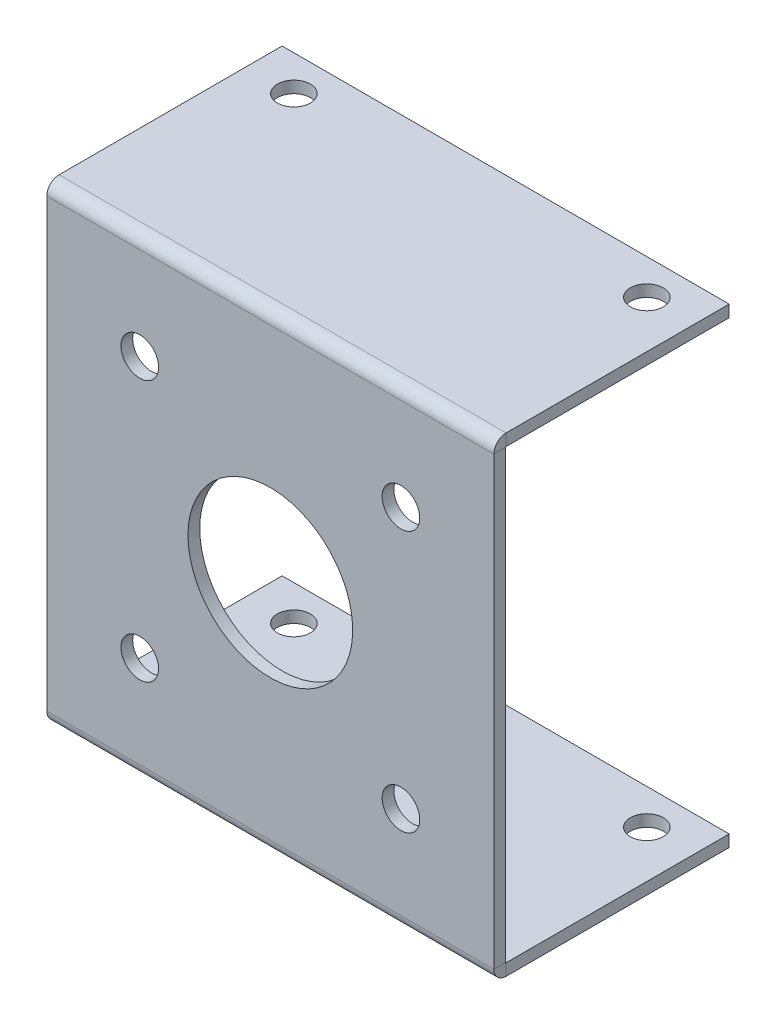
from build123d import *

# Parameters (mm, degrees)
SKETCH1_W                    = 190
SKETCH1_H                    = 200
BASE_FLANGE1_DEPTH           = 5
EDGE_FLANGE1_STRIP_W         = 20.4
EDGE_FLANGE1_STRIP_H         = 5
EDGE_FLANGE1_STRIP_CUT_DEPTH = 190
EDGE_FLANGE1_DEPTH           = 190
EDGE_FLANGE2_STRIP_W         = 20.4
EDGE_FLANGE2_STRIP_H         = 5
EDGE_FLANGE2_STRIP_CUT_DEPTH = 190
EDGE_FLANGE2_DEPTH           = 190
CUT_EXTRUDE1_DEPTH           = 171.367250374
CUT_EXTRUDE1_DEPTH_BACK      = 171.367250374
SKETCH12_R                   = 35
CUT_EXTRUDE2_DEPTH           = 171.367250374
CUT_EXTRUDE2_DEPTH_BACK      = 171.367250374
SKETCH13_R                   = 8
CUT_EXTRUDE3_DEPTH           = 243.950612265
CUT_EXTRUDE3_DEPTH_BACK      = 243.950612265
SKETCH14_R                   = 7


# Sheet-metal steps are written as plain solids
with BuildPart() as part:
    # Sketch1 → Base-Flange1 (new body)
    with BuildSketch(Plane.XY):
        Rectangle(SKETCH1_W, SKETCH1_H)
    extrude(amount=-BASE_FLANGE1_DEPTH)

    # Edge-Flange1 strip (across the edge) → Edge-Flange1 strip cut (cut)
    with BuildSketch(Plane(origin=(-95, 100, -5), x_dir=(0, -1, 0), z_dir=(1, 0, 0))):
        with Locations((-5, -2.5)):
            Rectangle(EDGE_FLANGE1_STRIP_W, EDGE_FLANGE1_STRIP_H)
    extrude(amount=EDGE_FLANGE1_STRIP_CUT_DEPTH, mode=Mode.SUBTRACT)

    # Edge-Flange1 section (across the edge) → Edge-Flange1 (add)
    with BuildSketch(Plane(origin=(-95, 100, -5), x_dir=(0, -1, 0), z_dir=(1, 0, 0))):
        with BuildLine():
            Line((0, 0.2), (0, 95))
            Line((0, 95), (5, 95))
            Line((5, 95), (5, 0.2))
            ThreePointArc((5, 0.2), (5.058578644, 0.058578644), (5.2, 0))
            Line((5.2, 0), (5.2, -5))
            ThreePointArc((5.2, -5), (1.523044738, -3.476955262), (0, 0.2))
        make_face()
    extrude(amount=EDGE_FLANGE1_DEPTH)

    # Edge-Flange2 strip (across the edge) → Edge-Flange2 strip cut (cut)
    with BuildSketch(Plane(origin=(95, -100, -5), x_dir=(0, 1, 0), z_dir=(-1, 0, 0))):
        with Locations((-5, -2.5)):
            Rectangle(EDGE_FLANGE2_STRIP_W, EDGE_FLANGE2_STRIP_H)
    extrude(amount=EDGE_FLANGE2_STRIP_CUT_DEPTH, mode=Mode.SUBTRACT)

    # Edge-Flange2 section (across the edge) → Edge-Flange2 (add)
    with BuildSketch(Plane(origin=(95, -100, -5), x_dir=(0, 1, 0), z_dir=(-1, 0, 0))):
        with BuildLine():
            Line((0, 0.2), (0, 95))
            Line((0, 95), (5, 95))
            Line((5, 95), (5, 0.2))
            ThreePointArc((5, 0.2), (5.058578644, 0.058578644), (5.2, 0))
            Line((5.2, 0), (5.2, -5))
            ThreePointArc((5.2, -5), (1.523044738, -3.476955262), (0, 0.2))
        make_face()
    extrude(amount=EDGE_FLANGE2_DEPTH)

    # Sketch12 → Cut-Extrude1 (cut, two sides: drawn at the far end of the back side and taken through both)
    with BuildSketch(Plane.XY.offset(-CUT_EXTRUDE1_DEPTH_BACK)):
        with Locations(Location((0, 0, 0), (0, 0, 180))):
            Circle(SKETCH12_R)
    extrude(amount=CUT_EXTRUDE1_DEPTH + CUT_EXTRUDE1_DEPTH_BACK, mode=Mode.SUBTRACT)

    # Sketch13 → Cut-Extrude2 (cut, two sides: drawn at the far end of the back side and taken through both)
    with BuildSketch(Plane.XY.offset(-CUT_EXTRUDE2_DEPTH_BACK)):
        with Locations(Location((55.5, 55.5, 0), (0, 0, 180))):
            Circle(SKETCH13_R)
        with Locations(Location((-55.5, 55.5, 0), (0, 0, 180))):
            Circle(SKETCH13_R)
        with Locations(Location((-55.5, -55.5, 0), (0, 0, 180))):
            Circle(SKETCH13_R)
        with Locations(Location((55.5, -55.5, 0), (0, 0, 180))):
            Circle(SKETCH13_R)
    extrude(amount=CUT_EXTRUDE2_DEPTH + CUT_EXTRUDE2_DEPTH_BACK, mode=Mode.SUBTRACT)

    # Sketch14 → Cut-Extrude3 (cut, two sides: drawn at the far end of the back side and taken through both)
    with BuildSketch(Plane(origin=(0, -100, 0), x_dir=(-1, 0, 0), z_dir=(0, -1, 0)).offset(-CUT_EXTRUDE3_DEPTH_BACK)):
        with Locations(Location((75, 85, 0), (0, 0, 270))):
            Circle(SKETCH14_R)
        with Locations(Location((-75, 85, 0), (0, 0, 270))):
            Circle(SKETCH14_R)
    extrude(amount=CUT_EXTRUDE3_DEPTH + CUT_EXTRUDE3_DEPTH_BACK, mode=Mode.SUBTRACT)


solid = part.part
